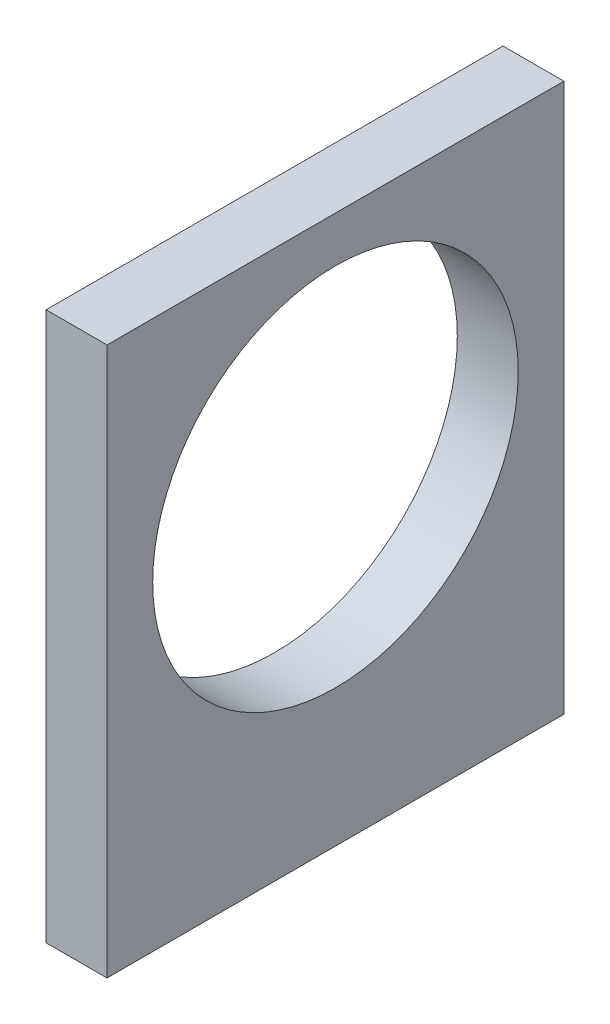
from build123d import *

# Parameters (mm, degrees)
SKETCH4_W                     = 47.625
SKETCH4_H                     = 57.15
SKETCH4_R                     = 19.05
BOSS_EXTRUDE2_DEPTH           = 6.35
TAP_DRILL_FOR_6_32_TAP1_D     = 2.7051
TAP_DRILL_FOR_6_32_TAP1_DEPTH = 12.7
TAP_DRILL_FOR_6_32_TAP1_TIP   = 0.81269403


with BuildPart() as part:
    # Sketch4 → Boss-Extrude2 (new body)
    with BuildSketch(Plane(origin=(0, 0, 0), x_dir=(0, 0, -1), z_dir=(1, 0, 0))):
        Rectangle(SKETCH4_W, SKETCH4_H)
        with Locations((0, 4.7625)):
            Circle(SKETCH4_R, mode=Mode.SUBTRACT)
    extrude(amount=BOSS_EXTRUDE2_DEPTH)

    # Tap Drill for #6-32 Tap1
    with Locations(Plane(origin=(0, -28.575, 0), x_dir=(-1, 0, 0), z_dir=(0, -1, 0))):
        with Locations((-3.175, 20.6375), (-3.175, -20.6375)):
            Hole(TAP_DRILL_FOR_6_32_TAP1_D / 2, depth=TAP_DRILL_FOR_6_32_TAP1_DEPTH)
            with Locations((0, 0, -(TAP_DRILL_FOR_6_32_TAP1_DEPTH + TAP_DRILL_FOR_6_32_TAP1_TIP / 2))):  # 118° drill point
                Cone(0, TAP_DRILL_FOR_6_32_TAP1_D / 2, TAP_DRILL_FOR_6_32_TAP1_TIP, mode=Mode.SUBTRACT)


solid = part.part
